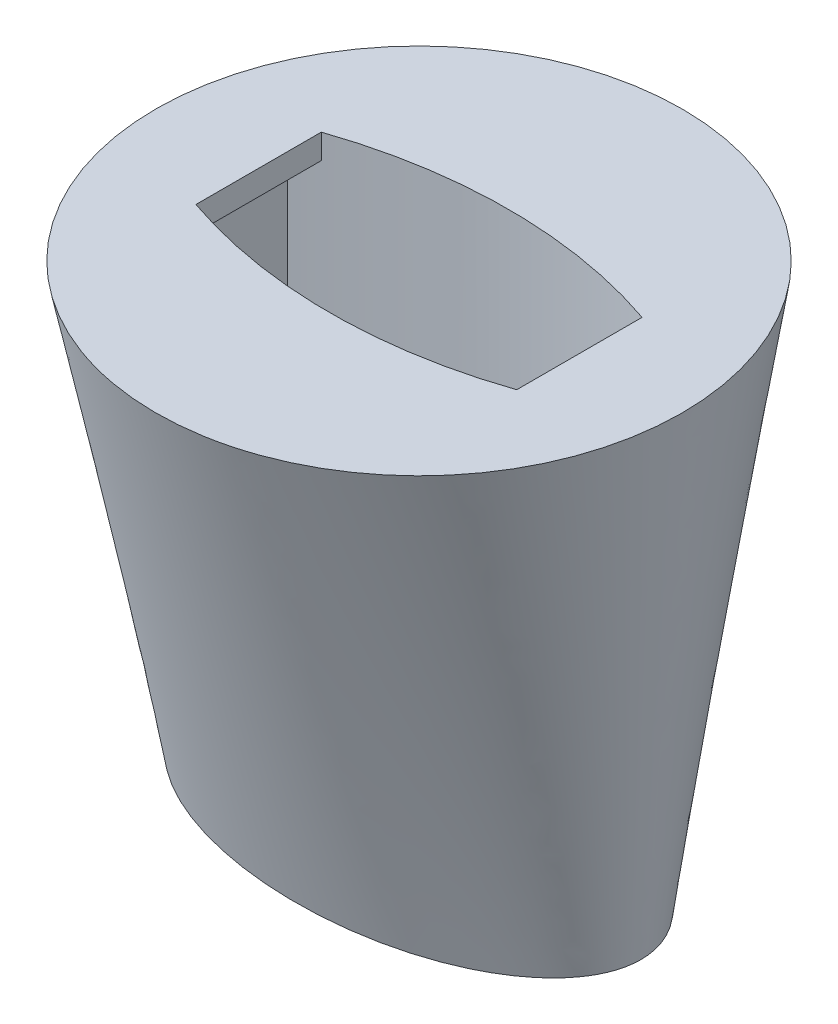
from build123d import *

# Parameters (mm, degrees)
SKETCH3_RX          = 27
SKETCH3_RY          = 15
BOSS_EXTRUDE1_DEPTH = 60.053544519
CUT_EXTRUDE1_DEPTH  = 99
BOSS_EXTRUDE2_DEPTH = 3


with BuildPart() as part:
    # Sketch3 → Boss-Extrude1 (new body)
    with BuildSketch(Plane(origin=(0, 0, 0), x_dir=(1, 0, 0), z_dir=(0, 1, 0))):
        with Locations((0, 0)):
            Ellipse(SKETCH3_RX, SKETCH3_RY)
        with BuildLine():
            Line((22.5, 6.5), (22.5, -6.5))
            ThreePointArc((22.5, -6.5), (0, -10.878511347), (-22.5, -6.5))
            Line((-22.5, -6.5), (-22.5, 6.5))
            ThreePointArc((-22.5, 6.5), (0, 10.878511347), (22.5, 6.5))
        make_face(mode=Mode.SUBTRACT)
    extrude(amount=BOSS_EXTRUDE1_DEPTH)

    # Loft9: read off the stored shape, not the designer's step
    # Loft9: loft between two sections, ruled curve by curve
    loft9_from = [
        Edge.make_bspline([(0.559362113, 0, -14.996780663), (-53.429048274, 0, -15.618294122), (-54.5477725, 0, 14.375267204), (-0.559362113, 0, 14.996780663), (53.429048274, 0, 15.618294122), (54.5477725, 0, -14.375267204), (0.559362113, 0, -14.996780663)], [0, 0, 0, 0, 0.5, 0.5, 0.5, 1, 1, 1, 1], 3, [1, 0.333333333, 0.333333333, 1, 0.333333333, 0.333333333, 1]),
    ]
    loft9_to = [
        Edge.make_bspline([(0.162188065, 60.053544519, -31.999588982), (-63.836989899, 60.053544519, -32.323965112), (-64.16136603, 60.053544519, 31.675212852), (-0.162188065, 60.053544519, 31.999588982), (63.836989899, 60.053544519, 32.323965112), (64.16136603, 60.053544519, -31.675212852), (0.162188065, 60.053544519, -31.999588982)], [0, 0, 0, 0, 0.5, 0.5, 0.5, 1, 1, 1, 1], 3, [1, 0.333333333, 0.333333333, 1, 0.333333333, 0.333333333, 1]),
    ]
    loft9 = Solid(Shell([*[Face.make_surface_from_curves(loft9_from[k], loft9_to[k]) for k in range(1)], Face(Wire(loft9_from)), Face(Wire(loft9_to))]))
    add(loft9)

    # Sketch5 → Cut-Extrude1 (cut)
    with BuildSketch(Plane(origin=(0, 60.053544519, 0), x_dir=(1, 0, 0), z_dir=(0, 1, 0))):
        with BuildLine():
            Line((22.5, 6.5), (22.5, -6.5))
            ThreePointArc((22.5, -6.5), (0, -10.878511347), (-22.5, -6.5))
            Line((-22.5, -6.5), (-22.5, 6.5))
            ThreePointArc((-22.5, 6.5), (0, 10.878511347), (22.5, 6.5))
        make_face()
    extrude(amount=-CUT_EXTRUDE1_DEPTH, mode=Mode.SUBTRACT)

    # Sketch5<4> → Boss-Extrude2 (add)
    with BuildSketch(Plane(origin=(0, 60.053544519, 0), x_dir=(1, 0, 0), z_dir=(0, 1, 0))):
        with BuildLine():
            Line((-19.5, -7.621352305), (-19.5, 7.621352305))
            ThreePointArc((-19.5, 7.621352305), (-21.007483375, 7.080696734), (-22.5, 6.5))
            Line((-22.5, 6.5), (-22.5, -6.5))
            ThreePointArc((-22.5, -6.5), (-21.007483375, -7.080696734), (-19.5, -7.621352305))
        make_face()
        with BuildLine():
            Line((22.5, -6.5), (22.5, 6.5))
            ThreePointArc((22.5, 6.5), (21.007483375, 7.080696734), (19.5, 7.621352305))
            Line((19.5, 7.621352305), (19.5, -7.621352305))
            ThreePointArc((19.5, -7.621352305), (21.007483375, -7.080696734), (22.5, -6.5))
        make_face()
    extrude(amount=-BOSS_EXTRUDE2_DEPTH)


solid = part.part
